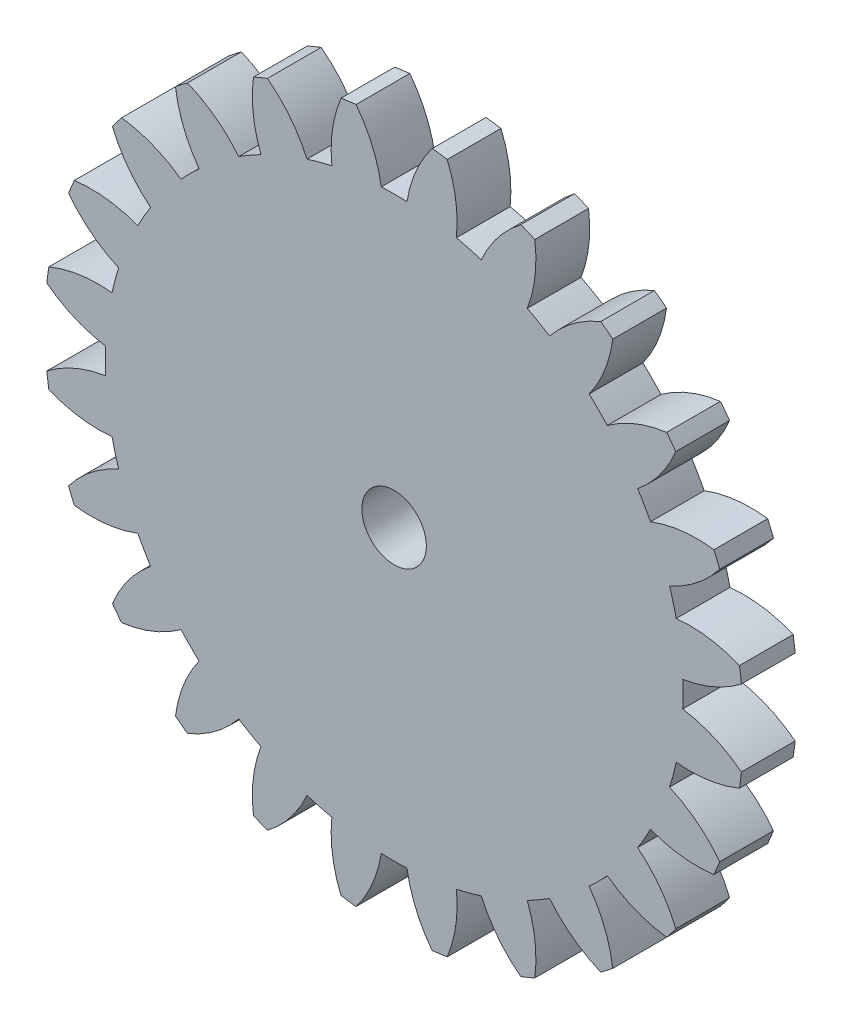
from build123d import *

# Parameters (mm, degrees)
SKETCH1_R           = 3
BOSS_EXTRUDE1_DEPTH = 5


with BuildPart() as part:
    # Sketch1 → Boss-Extrude1 (new body)
    with BuildSketch(Plane.XY):
        with BuildLine():
            ThreePointArc((-32.122270959, 4.940618226), (-32.221957995, 4.242101247), (-32.30645721, 3.541584753))
            ThreePointArc((-32.30645721, 3.541584753), (-29.724355705, 2.025732467), (-26.847359877, 1.196304146))
            ThreePointArc((-26.847359877, 1.196304146), (-26.874, 0), (-26.847359877, -1.196304146))
            ThreePointArc((-26.847359877, -1.196304146), (-29.724355705, -2.025732467), (-32.30645721, -3.541584753))
            ThreePointArc((-32.30645721, -3.541584753), (-32.221957995, -4.242101247), (-32.122270959, -4.940618226))
            ThreePointArc((-32.122270959, -4.940618226), (-29.235820988, -5.736522053), (-26.24218457, -5.793066977))
            ThreePointArc((-26.24218457, -5.793066977), (-25.958290656, -6.955503018), (-25.622931977, -8.104149117))
            ThreePointArc((-25.622931977, -8.104149117), (-28.187224703, -9.649936667), (-30.289011791, -11.782434585))
            ThreePointArc((-30.289011791, -11.782434585), (-30.026084807, -12.437211552), (-29.749005026, -13.086126239))
            ThreePointArc((-29.749005026, -13.086126239), (-26.754913385, -13.107842075), (-23.848647751, -12.387650158))
            ThreePointArc((-23.848647751, -12.387650158), (-23.273566701, -13.437), (-22.652343606, -14.459709719))
            ThreePointArc((-22.652343606, -14.459709719), (-24.729180918, -16.61651363), (-26.207420273, -19.220330971))
            ThreePointArc((-26.207420273, -19.220330971), (-25.783983559, -19.784746443), (-25.348393564, -20.339836374))
            ThreePointArc((-25.348393564, -20.339836374), (-22.45070265, -19.585884321), (-19.829865, -18.138035453))
            ThreePointArc((-19.829865, -18.138035453), (-19.002787638, -19.002787638), (-18.138035453, -19.829865))
            ThreePointArc((-18.138035453, -19.829865), (-19.585884321, -22.45070265), (-20.339836374, -25.348393564))
            ThreePointArc((-20.339836374, -25.348393564), (-19.784746443, -25.783983559), (-19.220330971, -26.207420273))
            ThreePointArc((-19.220330971, -26.207420273), (-16.61651363, -24.729180918), (-14.459709719, -22.652343606))
            ThreePointArc((-14.459709719, -22.652343606), (-13.437, -23.273566701), (-12.387650158, -23.848647751))
            ThreePointArc((-12.387650158, -23.848647751), (-13.107842075, -26.754913385), (-13.086126239, -29.749005026))
            ThreePointArc((-13.086126239, -29.749005026), (-12.437211552, -30.026084807), (-11.782434585, -30.289011791))
            ThreePointArc((-11.782434585, -30.289011791), (-9.649936667, -28.187224703), (-8.104149117, -25.622931977))
            ThreePointArc((-8.104149117, -25.622931977), (-6.955503018, -25.958290656), (-5.793066977, -26.24218457))
            ThreePointArc((-5.793066977, -26.24218457), (-5.736522053, -29.235820988), (-4.940618226, -32.122270959))
            ThreePointArc((-4.940618226, -32.122270959), (-4.242101247, -32.221957995), (-3.541584753, -32.30645721))
            ThreePointArc((-3.541584753, -32.30645721), (-2.025732467, -29.724355705), (-1.196304146, -26.847359877))
            ThreePointArc((-1.196304146, -26.847359877), (0, -26.874), (1.196304146, -26.847359877))
            ThreePointArc((1.196304146, -26.847359877), (2.025732467, -29.724355705), (3.541584753, -32.30645721))
            ThreePointArc((3.541584753, -32.30645721), (4.242101247, -32.221957995), (4.940618226, -32.122270959))
            ThreePointArc((4.940618226, -32.122270959), (5.736522053, -29.235820988), (5.793066977, -26.24218457))
            ThreePointArc((5.793066977, -26.24218457), (6.955503018, -25.958290656), (8.104149117, -25.622931977))
            ThreePointArc((8.104149117, -25.622931977), (9.649936667, -28.187224703), (11.782434585, -30.289011791))
            ThreePointArc((11.782434585, -30.289011791), (12.437211552, -30.026084807), (13.086126239, -29.749005026))
            ThreePointArc((13.086126239, -29.749005026), (13.107842075, -26.754913385), (12.387650158, -23.848647751))
            ThreePointArc((12.387650158, -23.848647751), (13.437, -23.273566701), (14.459709719, -22.652343606))
            ThreePointArc((14.459709719, -22.652343606), (16.61651363, -24.729180918), (19.220330971, -26.207420273))
            ThreePointArc((19.220330971, -26.207420273), (19.784746443, -25.783983559), (20.339836374, -25.348393564))
            ThreePointArc((20.339836374, -25.348393564), (19.585884321, -22.45070265), (18.138035453, -19.829865))
            ThreePointArc((18.138035453, -19.829865), (19.002787638, -19.002787638), (19.829865, -18.138035453))
            ThreePointArc((19.829865, -18.138035453), (22.45070265, -19.585884321), (25.348393564, -20.339836374))
            ThreePointArc((25.348393564, -20.339836374), (25.783983559, -19.784746443), (26.207420273, -19.220330971))
            ThreePointArc((26.207420273, -19.220330971), (24.729180918, -16.61651363), (22.652343606, -14.459709719))
            ThreePointArc((22.652343606, -14.459709719), (23.273566701, -13.437), (23.848647751, -12.387650158))
            ThreePointArc((23.848647751, -12.387650158), (26.754913385, -13.107842075), (29.749005026, -13.086126239))
            ThreePointArc((29.749005026, -13.086126239), (30.026084807, -12.437211552), (30.289011791, -11.782434585))
            ThreePointArc((30.289011791, -11.782434585), (28.187224703, -9.649936667), (25.622931977, -8.104149117))
            ThreePointArc((25.622931977, -8.104149117), (25.958290656, -6.955503018), (26.24218457, -5.793066977))
            ThreePointArc((26.24218457, -5.793066977), (29.235820988, -5.736522053), (32.122270959, -4.940618226))
            ThreePointArc((32.122270959, -4.940618226), (32.221957995, -4.242101247), (32.30645721, -3.541584753))
            ThreePointArc((32.30645721, -3.541584753), (29.724355705, -2.025732467), (26.847359877, -1.196304146))
            ThreePointArc((26.847359877, -1.196304146), (26.874, 0), (26.847359877, 1.196304146))
            ThreePointArc((26.847359877, 1.196304146), (29.724355705, 2.025732467), (32.30645721, 3.541584753))
            ThreePointArc((32.30645721, 3.541584753), (32.221957995, 4.242101247), (32.122270959, 4.940618226))
            ThreePointArc((32.122270959, 4.940618226), (29.235820988, 5.736522053), (26.24218457, 5.793066977))
            ThreePointArc((26.24218457, 5.793066977), (25.958290656, 6.955503018), (25.622931977, 8.104149117))
            ThreePointArc((25.622931977, 8.104149117), (28.187224703, 9.649936667), (30.289011791, 11.782434585))
            ThreePointArc((30.289011791, 11.782434585), (30.026084807, 12.437211552), (29.749005026, 13.086126239))
            ThreePointArc((29.749005026, 13.086126239), (26.754913385, 13.107842075), (23.848647751, 12.387650158))
            ThreePointArc((23.848647751, 12.387650158), (23.273566701, 13.437), (22.652343606, 14.459709719))
            ThreePointArc((22.652343606, 14.459709719), (24.729180918, 16.61651363), (26.207420273, 19.220330971))
            ThreePointArc((26.207420273, 19.220330971), (25.783983559, 19.784746443), (25.348393564, 20.339836374))
            ThreePointArc((25.348393564, 20.339836374), (22.45070265, 19.585884321), (19.829865, 18.138035453))
            ThreePointArc((19.829865, 18.138035453), (19.002787638, 19.002787638), (18.138035453, 19.829865))
            ThreePointArc((18.138035453, 19.829865), (19.585884321, 22.45070265), (20.339836374, 25.348393564))
            ThreePointArc((20.339836374, 25.348393564), (19.784746443, 25.783983559), (19.220330971, 26.207420273))
            ThreePointArc((19.220330971, 26.207420273), (16.61651363, 24.729180918), (14.459709719, 22.652343606))
            ThreePointArc((14.459709719, 22.652343606), (13.437, 23.273566701), (12.387650158, 23.848647751))
            ThreePointArc((12.387650158, 23.848647751), (13.107842075, 26.754913385), (13.086126239, 29.749005026))
            ThreePointArc((13.086126239, 29.749005026), (12.437211552, 30.026084807), (11.782434585, 30.289011791))
            ThreePointArc((11.782434585, 30.289011791), (9.649936667, 28.187224703), (8.104149117, 25.622931977))
            ThreePointArc((8.104149117, 25.622931977), (6.955503018, 25.958290656), (5.793066977, 26.24218457))
            ThreePointArc((5.793066977, 26.24218457), (5.736522053, 29.235820988), (4.940618226, 32.122270959))
            ThreePointArc((4.940618226, 32.122270959), (4.242101247, 32.221957995), (3.541584753, 32.30645721))
            ThreePointArc((3.541584753, 32.30645721), (2.025732467, 29.724355705), (1.196304146, 26.847359877))
            ThreePointArc((1.196304146, 26.847359877), (0, 26.874), (-1.196304146, 26.847359877))
            ThreePointArc((-1.196304146, 26.847359877), (-2.025732467, 29.724355705), (-3.541584753, 32.30645721))
            ThreePointArc((-3.541584753, 32.30645721), (-4.242101247, 32.221957995), (-4.940618226, 32.122270959))
            ThreePointArc((-4.940618226, 32.122270959), (-5.736522053, 29.235820988), (-5.793066977, 26.24218457))
            ThreePointArc((-5.793066977, 26.24218457), (-6.955503018, 25.958290656), (-8.104149117, 25.622931977))
            ThreePointArc((-8.104149117, 25.622931977), (-9.649936667, 28.187224703), (-11.782434585, 30.289011791))
            ThreePointArc((-11.782434585, 30.289011791), (-12.437211552, 30.026084807), (-13.086126239, 29.749005026))
            ThreePointArc((-13.086126239, 29.749005026), (-13.107842075, 26.754913385), (-12.387650158, 23.848647751))
            ThreePointArc((-12.387650158, 23.848647751), (-13.437, 23.273566701), (-14.459709719, 22.652343606))
            ThreePointArc((-14.459709719, 22.652343606), (-16.61651363, 24.729180918), (-19.220330971, 26.207420273))
            ThreePointArc((-19.220330971, 26.207420273), (-19.784746443, 25.783983559), (-20.339836374, 25.348393564))
            ThreePointArc((-20.339836374, 25.348393564), (-19.585884321, 22.45070265), (-18.138035453, 19.829865))
            ThreePointArc((-18.138035453, 19.829865), (-19.002787638, 19.002787638), (-19.829865, 18.138035453))
            ThreePointArc((-19.829865, 18.138035453), (-22.45070265, 19.585884321), (-25.348393564, 20.339836374))
            ThreePointArc((-25.348393564, 20.339836374), (-25.783983559, 19.784746443), (-26.207420273, 19.220330971))
            ThreePointArc((-26.207420273, 19.220330971), (-24.729180918, 16.61651363), (-22.652343606, 14.459709719))
            ThreePointArc((-22.652343606, 14.459709719), (-23.273566701, 13.437), (-23.848647751, 12.387650158))
            ThreePointArc((-23.848647751, 12.387650158), (-26.754913385, 13.107842075), (-29.749005026, 13.086126239))
            ThreePointArc((-29.749005026, 13.086126239), (-30.026084807, 12.437211552), (-30.289011791, 11.782434585))
            ThreePointArc((-30.289011791, 11.782434585), (-28.187224703, 9.649936667), (-25.622931977, 8.104149117))
            ThreePointArc((-25.622931977, 8.104149117), (-25.958290656, 6.955503018), (-26.24218457, 5.793066977))
            ThreePointArc((-26.24218457, 5.793066977), (-29.235820988, 5.736522053), (-32.122270959, 4.940618226))
        make_face()
        Circle(SKETCH1_R, mode=Mode.SUBTRACT)
    extrude(amount=BOSS_EXTRUDE1_DEPTH)


solid = part.part
